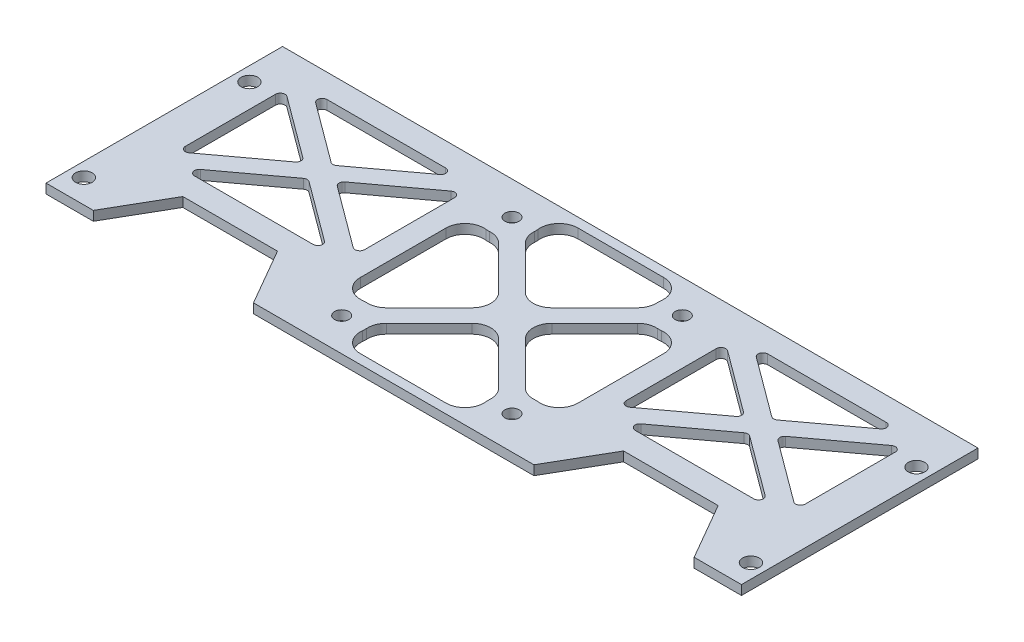
from build123d import *

# Parameters (mm, degrees)
SKETCH_1_W          = 147
SKETCH_1_H          = 50
SKETCH_1_R          = 1.5
EXTRUDE_1_DEPTH     = 2
CUT_EXTRUDE_1_DEPTH = 2
FILLET_2_DEPTH      = 2
FILLET_3_R          = 4
CUT_EXTRUDE_3_DEPTH = 78.661122835
SKETCH_7_R          = 1.75
CUT_EXTRUDE_4_DEPTH = 78.661122835
CUT_EXTRUDE_5_DEPTH = 10
FILLET_4_R          = 1


with BuildPart() as part:
    # 草图1 → 凸台-拉伸1 (new body)
    with BuildSketch(Plane(origin=(0, 0, 0), x_dir=(1, 0, 0), z_dir=(0, 1, 0))):
        Rectangle(SKETCH_1_W, SKETCH_1_H)
        with Locations(Location((18, -18, 0), (0, 0, 270))):
            Circle(SKETCH_1_R, mode=Mode.SUBTRACT)
        with Locations(Location((-18, -18, 0), (0, 0, 270))):
            Circle(SKETCH_1_R, mode=Mode.SUBTRACT)
        with Locations(Location((-18, 18, 0), (0, 0, 270))):
            Circle(SKETCH_1_R, mode=Mode.SUBTRACT)
        with Locations(Location((18, 18, 0), (0, 0, 270))):
            Circle(SKETCH_1_R, mode=Mode.SUBTRACT)
    extrude(amount=EXTRUDE_1_DEPTH)

    # 草图3 → 切除-拉伸1 (cut)
    with BuildSketch(Plane(origin=(0, 2, 0), x_dir=(1, 0, 0), z_dir=(0, 1, 0))):
        with BuildLine():
            Line((-13.345416088, 16.173843213), (0, 2.828427125))
            Line((0, 2.828427125), (13.345416088, 16.173843213))
            ThreePointArc((13.345416088, 16.173843213), (13.868972045, 20.816843629), (18, 23))
            Line((18, 23), (-18, 23))
            ThreePointArc((-18, 23), (-14.464466094, 21.535533906), (-13, 18))
            ThreePointArc((-13, 18), (-13.087112888, 17.070731352), (-13.345416088, 16.173843213))
        make_face()
        with BuildLine():
            Line((16.173843213, 13.345416088), (2.828427125, 0))
            Line((2.828427125, 0), (16.173843213, -13.345416088))
            ThreePointArc((16.173843213, -13.345416088), (20.816843629, -13.868972045), (23, -18))
            Line((23, -18), (23, 18))
            ThreePointArc((23, 18), (20.816843629, 13.868972045), (16.173843213, 13.345416088))
        make_face()
        with BuildLine():
            Line((0, -2.828427125), (-13.345416088, -16.173843213))
            ThreePointArc((-13.345416088, -16.173843213), (-13.087112888, -17.070731352), (-13, -18))
            ThreePointArc((-13, -18), (-14.464466094, -21.535533906), (-18, -23))
            Line((-18, -23), (18, -23))
            ThreePointArc((18, -23), (13.868972045, -20.816843629), (13.345416088, -16.173843213))
            Line((13.345416088, -16.173843213), (0, -2.828427125))
        make_face()
        with BuildLine():
            ThreePointArc((-23, -18), (-20.816843629, -13.868972045), (-16.173843213, -13.345416088))
            Line((-16.173843213, -13.345416088), (-2.828427125, 0))
            Line((-2.828427125, 0), (-16.173843213, 13.345416088))
            ThreePointArc((-16.173843213, 13.345416088), (-20.816843629, 13.868972045), (-23, 18))
            Line((-23, 18), (-23, -18))
        make_face()
    extrude(amount=-CUT_EXTRUDE_1_DEPTH, mode=Mode.SUBTRACT)

    # 圆角2: read off the stored shape, not the designer's step
    # 圆角2 outline → 圆角2 (add)
    with BuildSketch(Plane(origin=(0, 0, 0), x_dir=(1, 0, 0), z_dir=(0, 1, 0))):
        with BuildLine():
            Line((-23, 18), (-23, 9.05572809))
            ThreePointArc((-23, 9.05572809), (-21.666666667, 12.03715206), (-18.555555556, 13.03096005))
            ThreePointArc((-18.555555556, 13.03096005), (-21.726779962, 14.666666667), (-23, 18))
        make_face()
        with BuildLine():
            ThreePointArc((-18.555555556, -13.03096005), (-21.666666667, -12.03715206), (-23, -9.05572809))
            Line((-23, -9.05572809), (-23, -18))
            ThreePointArc((-23, -18), (-21.726779962, -14.666666667), (-18.555555556, -13.03096005))
        make_face()
        with BuildLine():
            ThreePointArc((13.03096005, -18.555555556), (12.03715206, -21.666666667), (9.05572809, -23))
            Line((9.05572809, -23), (18, -23))
            ThreePointArc((18, -23), (14.666666667, -21.726779962), (13.03096005, -18.555555556))
        make_face()
        with BuildLine():
            ThreePointArc((-9.05572809, -23), (-12.03715206, -21.666666667), (-13.03096005, -18.555555556))
            ThreePointArc((-13.03096005, -18.555555556), (-14.666666667, -21.726779962), (-18, -23))
            Line((-18, -23), (-9.05572809, -23))
        make_face()
        with BuildLine():
            ThreePointArc((18.555555556, 13.03096005), (21.666666667, 12.03715206), (23, 9.05572809))
            Line((23, 9.05572809), (23, 18))
            ThreePointArc((23, 18), (21.726779962, 14.666666667), (18.555555556, 13.03096005))
        make_face()
        with BuildLine():
            ThreePointArc((23, -9.05572809), (21.666666667, -12.03715206), (18.555555556, -13.03096005))
            ThreePointArc((18.555555556, -13.03096005), (21.726779962, -14.666666667), (23, -18))
            Line((23, -18), (23, -9.05572809))
        make_face()
        with BuildLine():
            ThreePointArc((-13.03096005, 18.555555556), (-12.03715206, 21.666666667), (-9.05572809, 23))
            Line((-9.05572809, 23), (-18, 23))
            ThreePointArc((-18, 23), (-14.666666667, 21.726779962), (-13.03096005, 18.555555556))
        make_face()
        with BuildLine():
            ThreePointArc((9.05572809, 23), (12.03715206, 21.666666667), (13.03096005, 18.555555556))
            ThreePointArc((13.03096005, 18.555555556), (14.666666667, 21.726779962), (18, 23))
            Line((18, 23), (9.05572809, 23))
        make_face()
    extrude(amount=FILLET_2_DEPTH)

    # 圆角3
    fillet_3_edges = [part.edges().sort_by_distance(p)[0] for p in [
        (13.345416088, 1, 16.173843213),
        (-13.345416088, 1, 16.173843213),
        (0, 1, 2.828427125),
        (16.173843213, 1, -13.345416088),
        (16.173843213, 1, 13.345416088),
        (2.828427125, 1, 0),
        (-16.173843213, 1, -13.345416088),
        (-2.828427125, 1, 0),
        (-16.173843213, 1, 13.345416088),
        (-13.345416088, 1, -16.173843213),
        (13.345416088, 1, -16.173843213),
        (0, 1, -2.828427125),
    ]]
    fillet(fillet_3_edges, radius=FILLET_3_R)

    # 草图6 → 切除-拉伸3 (cut, through all)
    with BuildSketch(Plane(origin=(0, 2, 0), x_dir=(1, 0, 0), z_dir=(0, 1, 0))):
        Polygon((63.5, -25), (56.57179677, -13), (36.57179677, -13), (29.643593539, -25), align=None)
    cut_extrude_3 = extrude(amount=-CUT_EXTRUDE_3_DEPTH, mode=Mode.SUBTRACT)

    # 镜向1: 切除-拉伸3 across plane
    add(cut_extrude_3.mirror(Plane(origin=(0, 0, 0), x_dir=(0, 0, 1), z_dir=(1, 0, 0))), mode=Mode.SUBTRACT)

    # 草图7 → 切除-拉伸4 (cut, through all)
    with BuildSketch(Plane.XZ):
        with Locations(Location((70.5, 20, 0), (0, 0, 270))):
            Circle(SKETCH_7_R)
        with Locations(Location((70.5, -15, 0), (0, 0, 270))):
            Circle(SKETCH_7_R)
        with Locations(Location((-70.5, -15, 0), (0, 0, 270))):
            Circle(SKETCH_7_R)
        with Locations(Location((-70.5, 20, 0), (0, 0, 270))):
            Circle(SKETCH_7_R)
    extrude(amount=-CUT_EXTRUDE_4_DEPTH, mode=Mode.SUBTRACT)

    # 草图8 → 切除-拉伸5 (cut)
    with BuildSketch(Plane.XZ):
        Polygon((-62.136702063, 8), (-46.57179677, -3.512380307), (-31.006891476, 8), align=None)
        Polygon((-27.643593539, 5.512380307), (-43.208498833, -6), (-27.643593539, -17.512380307), align=None)
        Polygon((-46.57179677, -8.487619693), (-62.136702063, -20), (-31.006891476, -20), align=None)
        Polygon((-65.5, 5.512380307), (-65.5, -17.512380307), (-49.935094706, -6), align=None)
        Polygon((27.643593539, -17.512380307), (43.208498833, -6), (27.643593539, 5.512380307), align=None)
        Polygon((31.006891476, 8), (46.57179677, -3.512380307), (62.136702063, 8), align=None)
        Polygon((49.935094706, -6), (65.5, -17.512380307), (65.5, 5.512380307), align=None)
        Polygon((62.136702063, -20), (46.57179677, -8.487619693), (31.006891476, -20), align=None)
    extrude(amount=-CUT_EXTRUDE_5_DEPTH, mode=Mode.SUBTRACT)

    # 圆角4
    fillet_4_edges = [part.edges().sort_by_distance(p)[0] for p in [
        (27.643593539, 1, -17.512380307),
        (27.643593539, 1, 5.512380307),
        (43.208498833, 1, -6),
        (-65.5, 1, -17.512380307),
        (-65.5, 1, 5.512380307),
        (-49.935094706, 1, -6),
        (-43.208498833, 1, -6),
        (-27.643593539, 1, 5.512380307),
        (-27.643593539, 1, -17.512380307),
        (-62.136702063, 1, -20),
        (-46.57179677, 1, -8.487619693),
        (-31.006891476, 1, -20),
        (62.136702063, 1, -20),
        (31.006891476, 1, -20),
        (46.57179677, 1, -8.487619693),
        (62.136702063, 1, 8),
        (46.57179677, 1, -3.512380307),
        (31.006891476, 1, 8),
        (65.5, 1, -17.512380307),
        (49.935094706, 1, -6),
        (65.5, 1, 5.512380307),
        (-46.57179677, 1, -3.512380307),
        (-62.136702063, 1, 8),
        (-31.006891476, 1, 8),
    ]]
    fillet(fillet_4_edges, radius=FILLET_4_R)


solid = part.part
